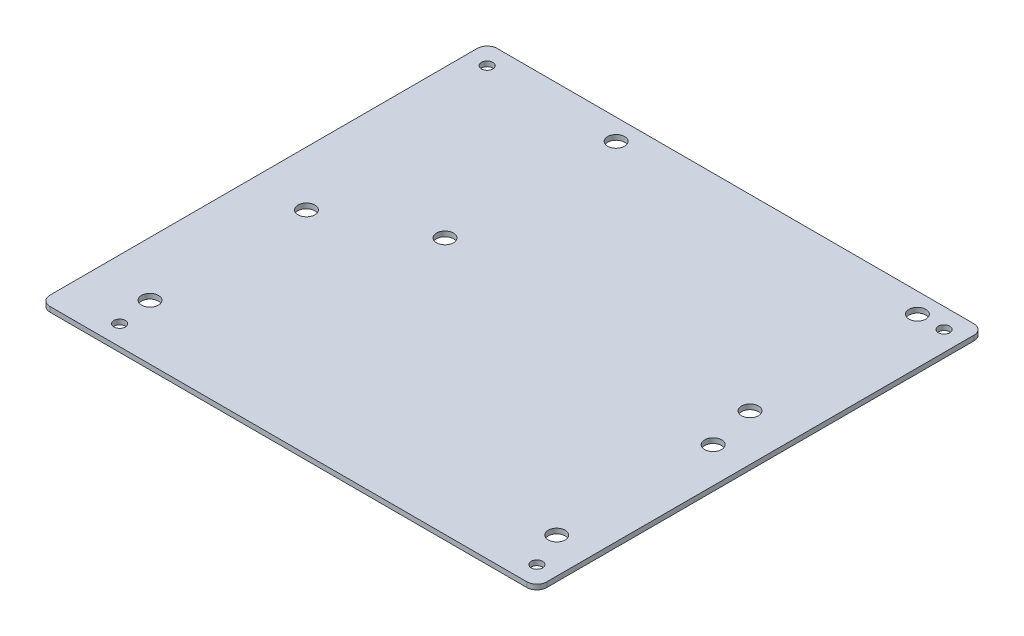
from build123d import *

# Parameters (mm, degrees)
SKETCH1_W           = 158.75
SKETCH1_H           = 142.875
BOSS_EXTRUDE1_DEPTH = 1.6002
FILLET1_R           = 3.175
SKETCH2_R           = 1.8288
CUT_EXTRUDE1_DEPTH  = 214.582276336
SKETCH5_R           = 2.7051
CUT_EXTRUDE2_DEPTH  = 214.582276336


with BuildPart() as part:
    # Sketch1 → Boss-Extrude1 (new body)
    with BuildSketch(Plane(origin=(0, 0, 0), x_dir=(1, 0, 0), z_dir=(0, 1, 0))):
        with Locations((79.375, 71.4375)):
            Rectangle(SKETCH1_W, SKETCH1_H)
    extrude(amount=BOSS_EXTRUDE1_DEPTH)

    # Fillet1
    fillet1_edges = [part.edges().sort_by_distance(p)[0] for p in [
        (158.75, 0.8001, 0),
        (0, 0.8001, -142.875),
        (158.75, 0.8001, -142.875),
        (0, 0.8001, 0),
    ]]
    fillet(fillet1_edges, radius=FILLET1_R)

    # Sketch2 → Cut-Extrude1 (cut, through all)
    with BuildSketch(Plane(origin=(0, 1.6002, 0), x_dir=(1, 0, 0), z_dir=(0, 1, 0))):
        with Locations((6.35, 136.525)):
            Circle(SKETCH2_R)
        with Locations((152.4, 136.525)):
            Circle(SKETCH2_R)
        with Locations((152.4, 6.35)):
            Circle(SKETCH2_R)
        with Locations((19.05, 6.35)):
            Circle(SKETCH2_R)
    extrude(amount=-CUT_EXTRUDE1_DEPTH, mode=Mode.SUBTRACT)

    # Sketch5 → Cut-Extrude2 (cut, through all)
    with BuildSketch(Plane(origin=(0, 1.6002, 0), x_dir=(1, 0, 0), z_dir=(0, 1, 0))):
        with Locations((47.93, 136.175)):
            Circle(SKETCH5_R)
        with Locations((143.912, 136.475)):
            Circle(SKETCH5_R)
        with Locations((47.295, 82.098)):
            Circle(SKETCH5_R)
        with Locations((143.912, 82.987)):
            Circle(SKETCH5_R)
        with Locations((17.4, 67.7)):
            Circle(SKETCH5_R)
        with Locations((147.382, 67.721)):
            Circle(SKETCH5_R)
        with Locations((147.4, 17.7)):
            Circle(SKETCH5_R)
        with Locations((17.4, 17.7)):
            Circle(SKETCH5_R)
    extrude(amount=-CUT_EXTRUDE2_DEPTH, mode=Mode.SUBTRACT)


solid = part.part
